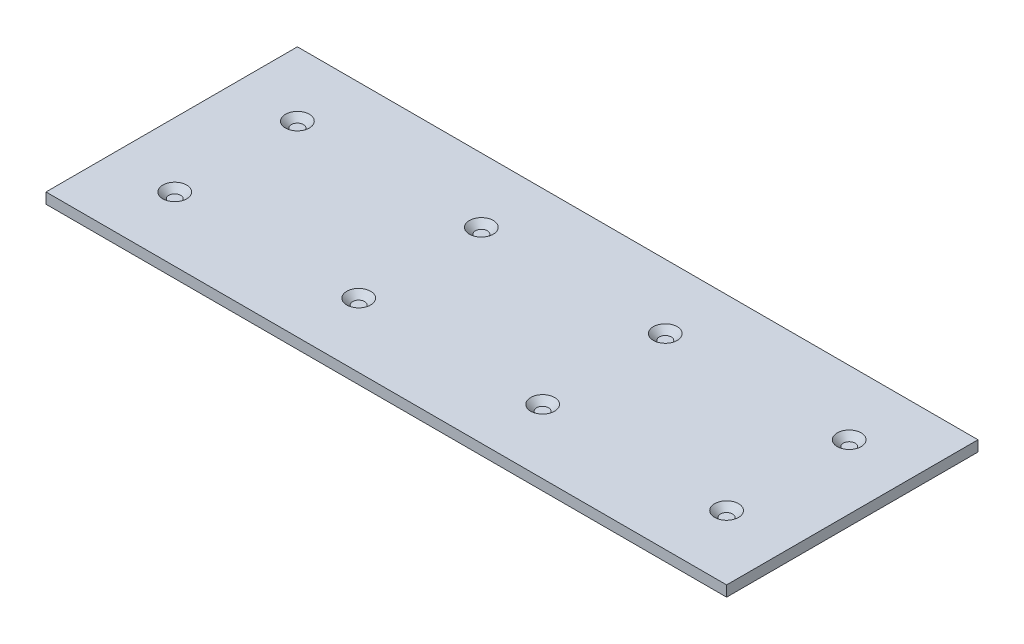
from build123d import *

# Parameters (mm, degrees)
SKETCH1_W                 = 255.3
SKETCH1_H                 = 94.3
BOSS_EXTRUDE1_DEPTH       = 4
ADVANCEDHOLE2_OUTLINE_R   = 2.25
ADVANCEDHOLE2_DEPTH       = 2.23
ADVANCEDHOLE2_DRAFT       = -45
ADVANCEDHOLE2_2_OUTLINE_R = 2.25
ADVANCEDHOLE2_2_DEPTH     = 2.23
ADVANCEDHOLE2_2_DRAFT     = -45
ADVANCEDHOLE2_3_OUTLINE_R = 2.25
ADVANCEDHOLE2_3_DEPTH     = 2.23
ADVANCEDHOLE2_3_DRAFT     = -45
ADVANCEDHOLE2_4_OUTLINE_R = 2.25
ADVANCEDHOLE2_4_DEPTH     = 2.23
ADVANCEDHOLE2_4_DRAFT     = -45
ADVANCEDHOLE2_5_OUTLINE_R = 2.25
ADVANCEDHOLE2_5_DEPTH     = 2.23
ADVANCEDHOLE2_5_DRAFT     = -45
ADVANCEDHOLE2_6_OUTLINE_R = 2.25
ADVANCEDHOLE2_6_DEPTH     = 2.23
ADVANCEDHOLE2_6_DRAFT     = -45
ADVANCEDHOLE2_7_OUTLINE_R = 2.25
ADVANCEDHOLE2_7_DEPTH     = 2.23
ADVANCEDHOLE2_7_DRAFT     = -45
ADVANCEDHOLE2_8_OUTLINE_R = 2.25
ADVANCEDHOLE2_8_DEPTH     = 2.23
ADVANCEDHOLE2_8_DRAFT     = -45


# Read off the part's stored shape, not the designer's step: AdvancedHole2
with BuildPart() as part:
    # Sketch1 → Boss-Extrude1 (new body)
    with BuildSketch(Plane(origin=(0, 0, 0), x_dir=(1, 0, 0), z_dir=(0, 1, 0))):
        with Locations((127.65, 47.15)):
            Rectangle(SKETCH1_W, SKETCH1_H)
    extrude(amount=BOSS_EXTRUDE1_DEPTH)


with BuildPart() as advancedhole2_tool:
    # AdvancedHole2 outline → AdvancedHole2 (with draft: the straight prism first)
    with BuildSketch(Plane(origin=(0, 1.77, 0), x_dir=(1, 0, 0), z_dir=(0, 1, 0))):
        with Locations((231.15, 24.15)):
            Circle(ADVANCEDHOLE2_OUTLINE_R)
    extrude(amount=ADVANCEDHOLE2_DEPTH)
    # AdvancedHole2: the draft: its side faces are tilted about the plane it starts from
    advancedhole2_sides = [advancedhole2_tool.faces().sort_by_distance(p)[0] for p in [
        (228.9, 2.885, -24.15),
    ]]
    draft(advancedhole2_sides, Plane(origin=(0, 1.77, 0), x_dir=(1, 0, 0), z_dir=(0, 1, 0)), ADVANCEDHOLE2_DRAFT)


with BuildPart() as part_1:
    add(part.part)

    # AdvancedHole2: cut by advancedhole2_tool
    add(advancedhole2_tool.part, mode=Mode.SUBTRACT)


with BuildPart() as advancedhole2_2_tool:
    # AdvancedHole2 2 outline → AdvancedHole2 2 (with draft: the straight prism first)
    with BuildSketch(Plane(origin=(0, 1.77, 0), x_dir=(1, 0, 0), z_dir=(0, 1, 0))):
        with Locations((231.15, 70.15)):
            Circle(ADVANCEDHOLE2_2_OUTLINE_R)
    extrude(amount=ADVANCEDHOLE2_2_DEPTH)
    # AdvancedHole2 2: the draft: its side faces are tilted about the plane it starts from
    advancedhole2_2_sides = [advancedhole2_2_tool.faces().sort_by_distance(p)[0] for p in [
        (228.9, 2.885, -70.15),
    ]]
    draft(advancedhole2_2_sides, Plane(origin=(0, 1.77, 0), x_dir=(1, 0, 0), z_dir=(0, 1, 0)), ADVANCEDHOLE2_2_DRAFT)


with BuildPart() as part_2:
    add(part_1.part)

    # AdvancedHole2 2: cut by advancedhole2_2_tool
    add(advancedhole2_2_tool.part, mode=Mode.SUBTRACT)


with BuildPart() as advancedhole2_3_tool:
    # AdvancedHole2 3 outline → AdvancedHole2 3 (with draft: the straight prism first)
    with BuildSketch(Plane(origin=(0, 1.77, 0), x_dir=(1, 0, 0), z_dir=(0, 1, 0))):
        with Locations((162.15, 70.15)):
            Circle(ADVANCEDHOLE2_3_OUTLINE_R)
    extrude(amount=ADVANCEDHOLE2_3_DEPTH)
    # AdvancedHole2 3: the draft: its side faces are tilted about the plane it starts from
    advancedhole2_3_sides = [advancedhole2_3_tool.faces().sort_by_distance(p)[0] for p in [
        (159.9, 2.885, -70.15),
    ]]
    draft(advancedhole2_3_sides, Plane(origin=(0, 1.77, 0), x_dir=(1, 0, 0), z_dir=(0, 1, 0)), ADVANCEDHOLE2_3_DRAFT)


with BuildPart() as part_3:
    add(part_2.part)

    # AdvancedHole2 3: cut by advancedhole2_3_tool
    add(advancedhole2_3_tool.part, mode=Mode.SUBTRACT)


with BuildPart() as advancedhole2_4_tool:
    # AdvancedHole2 4 outline → AdvancedHole2 4 (with draft: the straight prism first)
    with BuildSketch(Plane(origin=(0, 1.77, 0), x_dir=(1, 0, 0), z_dir=(0, 1, 0))):
        with Locations((162.15, 24.15)):
            Circle(ADVANCEDHOLE2_4_OUTLINE_R)
    extrude(amount=ADVANCEDHOLE2_4_DEPTH)
    # AdvancedHole2 4: the draft: its side faces are tilted about the plane it starts from
    advancedhole2_4_sides = [advancedhole2_4_tool.faces().sort_by_distance(p)[0] for p in [
        (159.9, 2.885, -24.15),
    ]]
    draft(advancedhole2_4_sides, Plane(origin=(0, 1.77, 0), x_dir=(1, 0, 0), z_dir=(0, 1, 0)), ADVANCEDHOLE2_4_DRAFT)


with BuildPart() as part_4:
    add(part_3.part)

    # AdvancedHole2 4: cut by advancedhole2_4_tool
    add(advancedhole2_4_tool.part, mode=Mode.SUBTRACT)


with BuildPart() as advancedhole2_5_tool:
    # AdvancedHole2 5 outline → AdvancedHole2 5 (with draft: the straight prism first)
    with BuildSketch(Plane(origin=(0, 1.77, 0), x_dir=(1, 0, 0), z_dir=(0, 1, 0))):
        with Locations((93.15, 24.15)):
            Circle(ADVANCEDHOLE2_5_OUTLINE_R)
    extrude(amount=ADVANCEDHOLE2_5_DEPTH)
    # AdvancedHole2 5: the draft: its side faces are tilted about the plane it starts from
    advancedhole2_5_sides = [advancedhole2_5_tool.faces().sort_by_distance(p)[0] for p in [
        (90.9, 2.885, -24.15),
    ]]
    draft(advancedhole2_5_sides, Plane(origin=(0, 1.77, 0), x_dir=(1, 0, 0), z_dir=(0, 1, 0)), ADVANCEDHOLE2_5_DRAFT)


with BuildPart() as part_5:
    add(part_4.part)

    # AdvancedHole2 5: cut by advancedhole2_5_tool
    add(advancedhole2_5_tool.part, mode=Mode.SUBTRACT)


with BuildPart() as advancedhole2_6_tool:
    # AdvancedHole2 6 outline → AdvancedHole2 6 (with draft: the straight prism first)
    with BuildSketch(Plane(origin=(0, 1.77, 0), x_dir=(1, 0, 0), z_dir=(0, 1, 0))):
        with Locations((93.15, 70.15)):
            Circle(ADVANCEDHOLE2_6_OUTLINE_R)
    extrude(amount=ADVANCEDHOLE2_6_DEPTH)
    # AdvancedHole2 6: the draft: its side faces are tilted about the plane it starts from
    advancedhole2_6_sides = [advancedhole2_6_tool.faces().sort_by_distance(p)[0] for p in [
        (90.9, 2.885, -70.15),
    ]]
    draft(advancedhole2_6_sides, Plane(origin=(0, 1.77, 0), x_dir=(1, 0, 0), z_dir=(0, 1, 0)), ADVANCEDHOLE2_6_DRAFT)


with BuildPart() as part_6:
    add(part_5.part)

    # AdvancedHole2 6: cut by advancedhole2_6_tool
    add(advancedhole2_6_tool.part, mode=Mode.SUBTRACT)


with BuildPart() as advancedhole2_7_tool:
    # AdvancedHole2 7 outline → AdvancedHole2 7 (with draft: the straight prism first)
    with BuildSketch(Plane(origin=(0, 1.77, 0), x_dir=(1, 0, 0), z_dir=(0, 1, 0))):
        with Locations((24.15, 24.15)):
            Circle(ADVANCEDHOLE2_7_OUTLINE_R)
    extrude(amount=ADVANCEDHOLE2_7_DEPTH)
    # AdvancedHole2 7: the draft: its side faces are tilted about the plane it starts from
    advancedhole2_7_sides = [advancedhole2_7_tool.faces().sort_by_distance(p)[0] for p in [
        (21.9, 2.885, -24.15),
    ]]
    draft(advancedhole2_7_sides, Plane(origin=(0, 1.77, 0), x_dir=(1, 0, 0), z_dir=(0, 1, 0)), ADVANCEDHOLE2_7_DRAFT)


with BuildPart() as part_7:
    add(part_6.part)

    # AdvancedHole2 7: cut by advancedhole2_7_tool
    add(advancedhole2_7_tool.part, mode=Mode.SUBTRACT)


with BuildPart() as advancedhole2_8_tool:
    # AdvancedHole2 8 outline → AdvancedHole2 8 (with draft: the straight prism first)
    with BuildSketch(Plane(origin=(0, 1.77, 0), x_dir=(1, 0, 0), z_dir=(0, 1, 0))):
        with Locations((24.15, 70.15)):
            Circle(ADVANCEDHOLE2_8_OUTLINE_R)
    extrude(amount=ADVANCEDHOLE2_8_DEPTH)
    # AdvancedHole2 8: the draft: its side faces are tilted about the plane it starts from
    advancedhole2_8_sides = [advancedhole2_8_tool.faces().sort_by_distance(p)[0] for p in [
        (21.9, 2.885, -70.15),
    ]]
    draft(advancedhole2_8_sides, Plane(origin=(0, 1.77, 0), x_dir=(1, 0, 0), z_dir=(0, 1, 0)), ADVANCEDHOLE2_8_DRAFT)


with BuildPart() as part_8:
    add(part_7.part)

    # AdvancedHole2 8: cut by advancedhole2_8_tool
    add(advancedhole2_8_tool.part, mode=Mode.SUBTRACT)


solid = part_8.part
